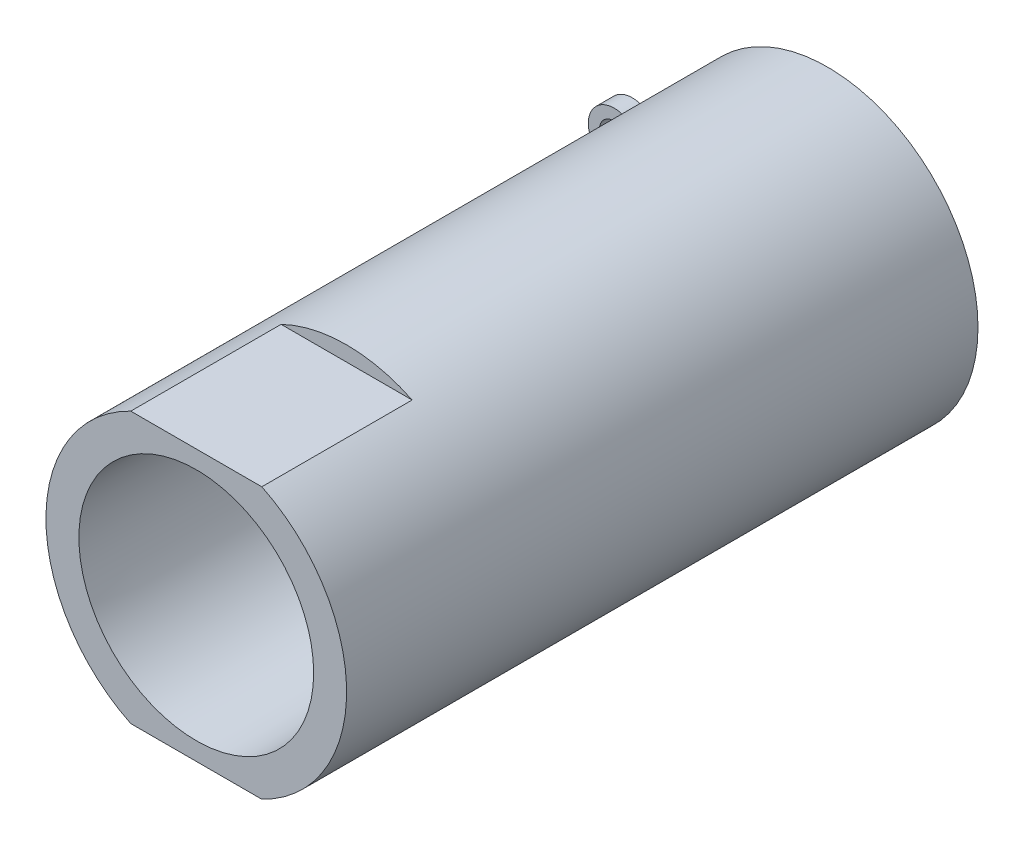
from build123d import *

# Parameters (mm, degrees)
SKETCH1_R           = 10
BOSS_EXTRUDE1_DEPTH = 42
CUT_EXTRUDE1_REACH  = 46.317
SKETCH2_R           = 5.25
SKETCH3_R           = 7.25
CUT_EXTRUDE2_DEPTH  = 32
SKETCH4_R           = 1
SKETCH4_R_2         = 5.25
BOSS_EXTRUDE2_DEPTH = 1.2
CUT_EXTRUDE3_START  = -10
CUT_EXTRUDE3_DEPTH  = 10
DRAFT1_ANGLE        = 1
CHAMFER1_SIZE       = 3
CHAMFER1_SIZE_2     = 3.053760573


with BuildPart() as part:
    # Sketch1 → Boss-Extrude1 (new body)
    with BuildSketch(Plane.XY):
        with Locations(Location((0, 0, 0), (0, 0, 180))):
            Circle(SKETCH1_R)
    extrude(amount=BOSS_EXTRUDE1_DEPTH)

    # Sketch2 → Cut-Extrude1 (cut, up to next)
    with BuildSketch(Plane.XY.offset(42), mode=Mode.PRIVATE) as cut_extrude1_sk1:
        Circle(SKETCH2_R)
    cut_extrude1_tool1 = extrude(cut_extrude1_sk1.sketch, amount=-CUT_EXTRUDE1_REACH, mode=Mode.PRIVATE) & part.part
    add(cut_extrude1_tool1.solids().sort_by_distance((0, 0, 42))[0], mode=Mode.SUBTRACT)

    # Sketch3 → Cut-Extrude2 (cut)
    with BuildSketch(Plane.XY.offset(42)):
        Circle(SKETCH3_R)
    extrude(amount=-CUT_EXTRUDE2_DEPTH, mode=Mode.SUBTRACT)

    # Sketch4 → Boss-Extrude2 (add)
    with BuildSketch(Plane(origin=(0, 0, 0), x_dir=(-1, 0, 0), z_dir=(0, 0, -1))):
        with BuildLine():
            Line((9.98013969, -0.629929975), (11.372178356, -0.629929975))
            ThreePointArc((11.372178356, -0.629929975), (14.722138794, 0.000600368), (11.372121573, 0.630828953))
            Line((11.372121573, 0.630828953), (9.980082907, 0.630828953))
            ThreePointArc((9.980082907, 0.630828953), (-9.99999999, -0.000450385), (9.98013969, -0.629929975))
        make_face()
        with Locations((12.987833992, 0.000522257)):
            Circle(SKETCH4_R, mode=Mode.SUBTRACT)
        with Locations(Location((0, 0, 0), (0, 0, 180))):
            Circle(SKETCH4_R_2, mode=Mode.SUBTRACT)
    extrude(amount=-BOSS_EXTRUDE2_DEPTH)

    # Sketch5 → Cut-Extrude3 (cut)
    with BuildSketch(Plane.XY.offset(42).offset(CUT_EXTRUDE3_START)):
        with BuildLine():
            ThreePointArc((4.358898944, 9), (0, 10), (-4.358898944, 9))
            Line((-4.358898944, 9), (4.358898944, 9))
        make_face()
        with BuildLine():
            Line((4.358898944, -9), (-4.358898944, -9))
            ThreePointArc((-4.358898944, -9), (0, -10), (4.358898944, -9))
        make_face()
    extrude(amount=CUT_EXTRUDE3_DEPTH, mode=Mode.SUBTRACT)

    # Draft1
    draft1_faces = [part.faces().sort_by_distance(p)[0] for p in [
        (-7.25, 0, 26),
    ]]
    draft(draft1_faces, Plane.XY.offset(10), DRAFT1_ANGLE)

    # Chamfer1
    # the kernel refuses this chamfer: 3.053760573, 3 mm, written as the material it adds along each edge
    with BuildSketch(Plane(origin=(0, 0, 10), x_dir=(1, 0, 0), z_dir=(0, -1, 0))) as chamfer1_piece_1_section:
        Polygon((7.25 - CHAMFER1_SIZE, 0), (7.25 + CHAMFER1_SIZE_2 * 0.0174524064385, CHAMFER1_SIZE_2 * 0.999847695226), (7.25, 0), align=None)
    chamfer1_piece_1 = revolve(axis=Axis((0, 0, 10), (0, 0, 1)), mode=Mode.PRIVATE)
    chamfer1_piece_1 = chamfer1_piece_1 - Plane(origin=(0, 0, 12.029896957), x_dir=(1, 0, 0), z_dir=(0, 0, 1)) * Cylinder(5.25, 30, mode=Mode.PRIVATE)
    add(chamfer1_piece_1)


solid = part.part
